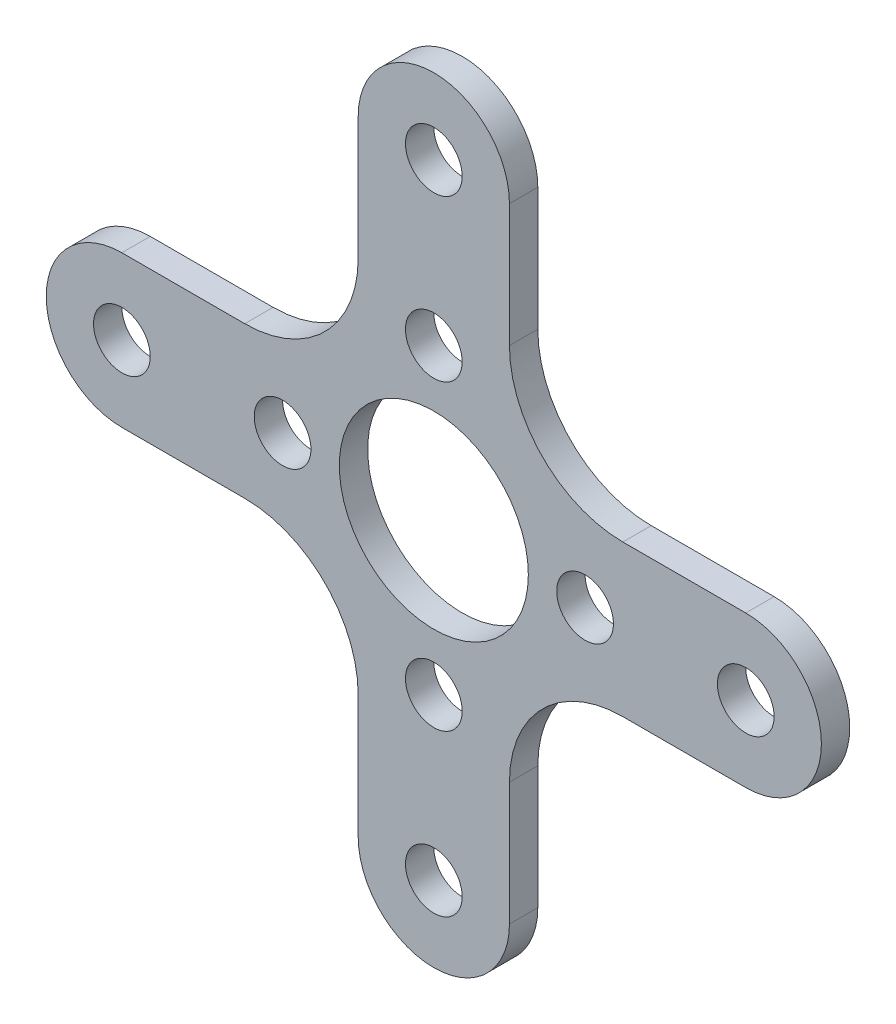
from build123d import *

# Parameters (mm, degrees)
IZIM1_R                     = 1.5
IZIM1_R_2                   = 5
Y_KSEKLIK_EKSTR_ZYON1_DEPTH = 1.5


with BuildPart() as part:
    # Çizim1 → Yükseklik-Ekstrüzyon1 (new body)
    with BuildSketch(Plane.XY):
        with BuildLine():
            Line((10.000000001, 4), (16.500000178, 4))
            ThreePointArc((16.500000178, 4), (20.500000178, 0), (16.500000178, -4))
            Line((16.500000178, -4), (10.000000001, -4))
            ThreePointArc((10.000000001, -4), (5.757359428, -5.757359376), (4.000000178, -10.000000001))
            Line((4.000000178, -10.000000001), (4.000000178, -16.500000178))
            ThreePointArc((4.000000178, -16.500000178), (1.78e-07, -20.500000178), (-3.999999822, -16.500000178))
            Line((-3.999999822, -16.500000178), (-3.999999822, -10.000000001))
            ThreePointArc((-3.999999822, -10.000000001), (-5.757359198, -5.757359428), (-9.999999823, -4.000000178))
            Line((-9.999999823, -4.000000178), (-16.5, -4.000000178))
            ThreePointArc((-16.5, -4.000000178), (-20.5, -1.78e-07), (-16.5, 3.999999822))
            Line((-16.5, 3.999999822), (-9.999999823, 3.999999822))
            ThreePointArc((-9.999999823, 3.999999822), (-5.75735925, 5.757359198), (-4, 9.999999823))
            Line((-4, 9.999999823), (-4, 16.5))
            ThreePointArc((-4, 16.5), (0, 20.5), (4, 16.5))
            Line((4, 16.5), (4, 9.999999823))
            ThreePointArc((4, 9.999999823), (5.757359376, 5.75735925), (10.000000001, 4))
        make_face()
        with Locations((0, 8)):
            Circle(IZIM1_R, mode=Mode.SUBTRACT)
        with Locations((16.500000178, 0)):
            Circle(IZIM1_R, mode=Mode.SUBTRACT)
        with Locations((8.000000178, 0)):
            Circle(IZIM1_R, mode=Mode.SUBTRACT)
        with Locations((0, 16.5)):
            Circle(IZIM1_R, mode=Mode.SUBTRACT)
        with Locations((1.78e-07, -16.500000178)):
            Circle(IZIM1_R, mode=Mode.SUBTRACT)
        with Locations((1.78e-07, -8.000000178)):
            Circle(IZIM1_R, mode=Mode.SUBTRACT)
        Circle(IZIM1_R_2, mode=Mode.SUBTRACT)
        with Locations((-16.5, -1.78e-07)):
            Circle(IZIM1_R, mode=Mode.SUBTRACT)
        with Locations((-8, -1.78e-07)):
            Circle(IZIM1_R, mode=Mode.SUBTRACT)
    extrude(amount=Y_KSEKLIK_EKSTR_ZYON1_DEPTH)


solid = part.part
